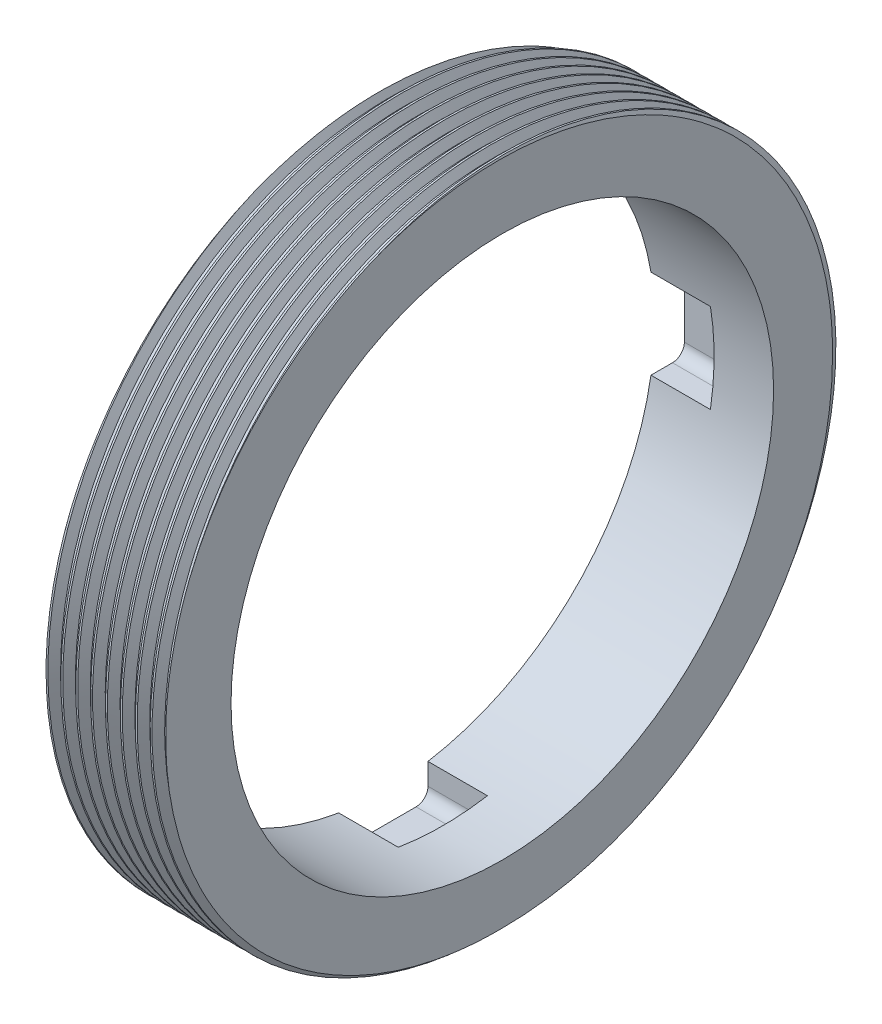
from build123d import *

# Parameters (mm, degrees)
SKETCH1_W          = 12.7
SKETCH1_H          = 6.2865
CUT_EXTRUDE1_DEPTH = 6.35
CIRPATTERN1_COUNT  = 4
THREAD1_PITCH      = 1.5875
THREAD1_FROM       = 1.5875
THREAD1_TO         = 14.2875


with BuildPart() as part:
    # Sketch1 → Revolve1 (revolve)
    with BuildSketch(Plane.XY, mode=Mode.PRIVATE) as revolve1_sk:
        with Locations((6.35, 32.09925)):
            Rectangle(SKETCH1_W, SKETCH1_H)
    revolve(revolve1_sk.sketch.rotate(Axis((0, 0, 0), (1, 0, 0)), 90), axis=Axis((0, 0, 0), (1, 0, 0)))

    # Sketch2 → Cut-Extrude1 (cut)
    with BuildSketch(Plane.ZY):
        with BuildLine():
            Line((32.131, 3.4925), (32.131, -3.4925))
            ThreePointArc((32.131, -3.4925), (31.759025612, -4.390525612), (30.861, -4.7625))
            Line((30.861, -4.7625), (0, -4.7625))
            Line((0, -4.7625), (0, 4.7625))
            Line((0, 4.7625), (30.861, 4.7625))
            ThreePointArc((30.861, 4.7625), (31.759025612, 4.390525612), (32.131, 3.4925))
        make_face()
    cut_extrude1 = extrude(amount=-CUT_EXTRUDE1_DEPTH, mode=Mode.SUBTRACT)

    # CirPattern1: Cut-Extrude1 ×4 about axis
    cirpattern1_axis = Axis((0, 0, 0), (1, 0, 0))
    for i in range(1, CIRPATTERN1_COUNT):
        add(cut_extrude1.rotate(cirpattern1_axis, i * 360 / CIRPATTERN1_COUNT), mode=Mode.SUBTRACT)

    # Thread1: arcs per turn and ends read off the stored shape
    # Thread1: the profile of Thread Profile1 profile screwed along a right-hand helix through 9 turns, 8 arcs to a turn; built about Z, then put on its axis
    thread1_z = Axis((0, 0, 0), (0, 0, 1))
    thread1_corners = [(35.2422, 0, -0.000173205), (36.101759577, 0, 0.496093748), (36.101759577, 0, 0.694531248), (35.2422, 0, 1.190798201)]
    with BuildLine(mode=Mode.PRIVATE) as thread1_profile:
        Line(thread1_corners[0], thread1_corners[1])
        Line(thread1_corners[1], thread1_corners[2])
        Line(thread1_corners[2], thread1_corners[3])
        Line(thread1_corners[3], thread1_corners[0])
    thread1_cap = Face(thread1_profile.wire())
    thread1_turn_angles = [0, 22.5, 45, 67.5, 90, 112.5, 135, 157.5, 180, 202.5, 225, 247.5, 270, 292.5, 315, 337.5, 360]
    thread1_turn_weights = [1, 0.9238795325112867, 1, 0.9238795325112867, 1, 0.9238795325112867, 1, 0.9238795325112867, 1, 0.9238795325112867, 1, 0.9238795325112867, 1, 0.9238795325112867, 1, 0.9238795325112867, 1]
    thread1_turn_rails = [Edge.make_bspline([Vector(p[0], p[1], 0).rotate(thread1_z, thread1_turn_angles[k]) / thread1_turn_weights[k] + Vector(0, 0, p[2] + THREAD1_PITCH * thread1_turn_angles[k] / 360) for k in range(17)], [0, 0, 0, 1, 1, 2, 2, 3, 3, 4, 4, 5, 5, 6, 6, 7, 7, 8, 8, 8], 2, thread1_turn_weights) for p in thread1_corners]
    thread1_turn_sides = [Face.make_surface_from_curves(thread1_turn_rails[p[0]], thread1_turn_rails[p[1]]) for p in [(0, 1), (1, 2), (2, 3), (3, 0)]]
    thread1 = Plane(origin=(14.2875, 0, 0), x_dir=(0, 0, -1), z_dir=(-1, 0, 0)) * split(split(Solid(Shell([*[p.moved(Location((0, 0, THREAD1_PITCH * i))) for i in range(9) for p in thread1_turn_sides], thread1_cap, thread1_cap.rotate(thread1_z, 3240).moved(Location((0, 0, THREAD1_PITCH * 3240 / 360)))])), bisect_by=Plane.XY.offset(THREAD1_FROM), keep=Keep.TOP, mode=Mode.PRIVATE), bisect_by=Plane.XY.offset(THREAD1_TO), keep=Keep.BOTTOM, mode=Mode.PRIVATE)
    add(thread1)


solid = part.part
